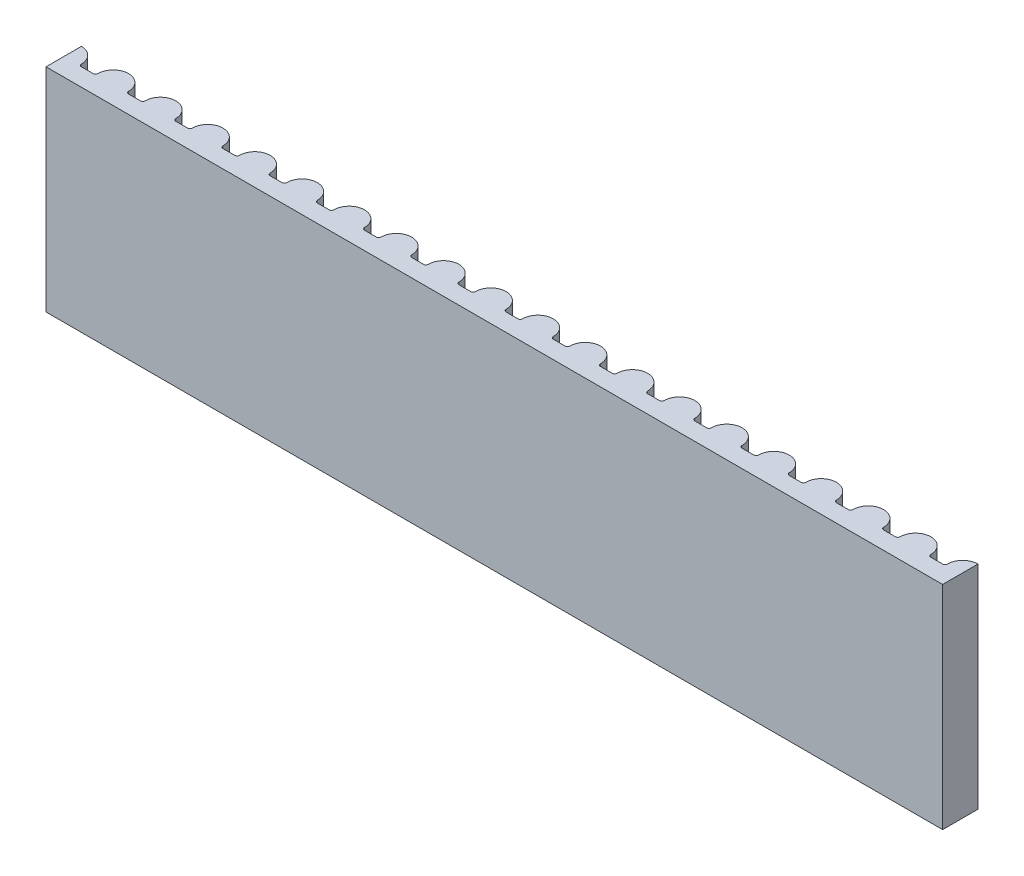
from build123d import *

# Parameters (mm, degrees)
BOSS_EXTRUDE1_DEPTH = 4.5
LPATTERN2_COUNT     = 10
LPATTERN2_PITCH     = 2
LPATTERN3_COUNT     = 10
LPATTERN3_PITCH     = 2


with BuildPart() as part:
    # Sketch1 → Boss-Extrude1 (new, symmetric)
    with BuildSketch(Plane(origin=(0, 0, 0), x_dir=(1, 0, 0), z_dir=(0, 1, 0))):
        with BuildLine():
            Line((0, 0), (1, 0))
            Line((1, 0), (1, 1.5))
            ThreePointArc((1, 1.5), (0.540380592, 1.309619408), (0.35, 0.85))
            ThreePointArc((0.35, 0.85), (0.320710678, 0.779289322), (0.25, 0.75))
            Line((0.25, 0.75), (0, 0.75))
            Line((0, 0.75), (0, 0))
        make_face()
    boss_extrude1 = extrude(amount=BOSS_EXTRUDE1_DEPTH, both=True)

    # Mirror1: Boss-Extrude1 across plane
    add(boss_extrude1.mirror(Plane(origin=(0, 4.5, -0.75), x_dir=(0, 0, 1), z_dir=(1, 0, 0))))


with BuildPart() as lpattern2_1:
    # LPattern2: pattern copy
    add(part.part.moved(Location(Vector(1, 0, 0) * (1 * LPATTERN2_PITCH))))


with BuildPart() as lpattern2_2:
    # LPattern2: pattern copy
    add(part.part.moved(Location(Vector(1, 0, 0) * (2 * LPATTERN2_PITCH))))


with BuildPart() as lpattern2_3:
    # LPattern2: pattern copy
    add(part.part.moved(Location(Vector(1, 0, 0) * (3 * LPATTERN2_PITCH))))


with BuildPart() as lpattern2_4:
    # LPattern2: pattern copy
    add(part.part.moved(Location(Vector(1, 0, 0) * (4 * LPATTERN2_PITCH))))


with BuildPart() as lpattern2_5:
    # LPattern2: pattern copy
    add(part.part.moved(Location(Vector(1, 0, 0) * (5 * LPATTERN2_PITCH))))


with BuildPart() as lpattern2_6:
    # LPattern2: pattern copy
    add(part.part.moved(Location(Vector(1, 0, 0) * (6 * LPATTERN2_PITCH))))


with BuildPart() as lpattern2_7:
    # LPattern2: pattern copy
    add(part.part.moved(Location(Vector(1, 0, 0) * (7 * LPATTERN2_PITCH))))


with BuildPart() as lpattern2_8:
    # LPattern2: pattern copy
    add(part.part.moved(Location(Vector(1, 0, 0) * (8 * LPATTERN2_PITCH))))


with BuildPart() as lpattern2_9:
    # LPattern2: pattern copy
    add(part.part.moved(Location(Vector(1, 0, 0) * (9 * LPATTERN2_PITCH))))


with BuildPart() as lpattern3_1:
    # LPattern3: pattern copy
    add(part.part.moved(Location(Vector(-1, 0, 0) * (1 * LPATTERN3_PITCH))))


with BuildPart() as lpattern3_2:
    # LPattern3: pattern copy
    add(part.part.moved(Location(Vector(-1, 0, 0) * (2 * LPATTERN3_PITCH))))


with BuildPart() as lpattern3_3:
    # LPattern3: pattern copy
    add(part.part.moved(Location(Vector(-1, 0, 0) * (3 * LPATTERN3_PITCH))))


with BuildPart() as lpattern3_4:
    # LPattern3: pattern copy
    add(part.part.moved(Location(Vector(-1, 0, 0) * (4 * LPATTERN3_PITCH))))


with BuildPart() as lpattern3_5:
    # LPattern3: pattern copy
    add(part.part.moved(Location(Vector(-1, 0, 0) * (5 * LPATTERN3_PITCH))))


with BuildPart() as lpattern3_6:
    # LPattern3: pattern copy
    add(part.part.moved(Location(Vector(-1, 0, 0) * (6 * LPATTERN3_PITCH))))


with BuildPart() as lpattern3_7:
    # LPattern3: pattern copy
    add(part.part.moved(Location(Vector(-1, 0, 0) * (7 * LPATTERN3_PITCH))))


with BuildPart() as lpattern3_8:
    # LPattern3: pattern copy
    add(part.part.moved(Location(Vector(-1, 0, 0) * (8 * LPATTERN3_PITCH))))


with BuildPart() as lpattern3_9:
    # LPattern3: pattern copy
    add(part.part.moved(Location(Vector(-1, 0, 0) * (9 * LPATTERN3_PITCH))))


with BuildPart() as part_1:
    add(part.part)

    # Combine1: union LPattern2_1, LPattern2_2, LPattern2_3, LPattern2_4, LPattern2_5, LPattern2_6, LPattern2_7, LPattern2_8, LPattern2_9, LPattern3_1, LPattern3_2, LPattern3_3, LPattern3_4, LPattern3_5, LPattern3_6, LPattern3_7, LPattern3_8, LPattern3_9
    add(lpattern2_1.part)
    add(lpattern2_2.part)
    add(lpattern2_3.part)
    add(lpattern2_4.part)
    add(lpattern2_5.part)
    add(lpattern2_6.part)
    add(lpattern2_7.part)
    add(lpattern2_8.part)
    add(lpattern2_9.part)
    add(lpattern3_1.part)
    add(lpattern3_2.part)
    add(lpattern3_3.part)
    add(lpattern3_4.part)
    add(lpattern3_5.part)
    add(lpattern3_6.part)
    add(lpattern3_7.part)
    add(lpattern3_8.part)
    add(lpattern3_9.part)


solid = part_1.part
